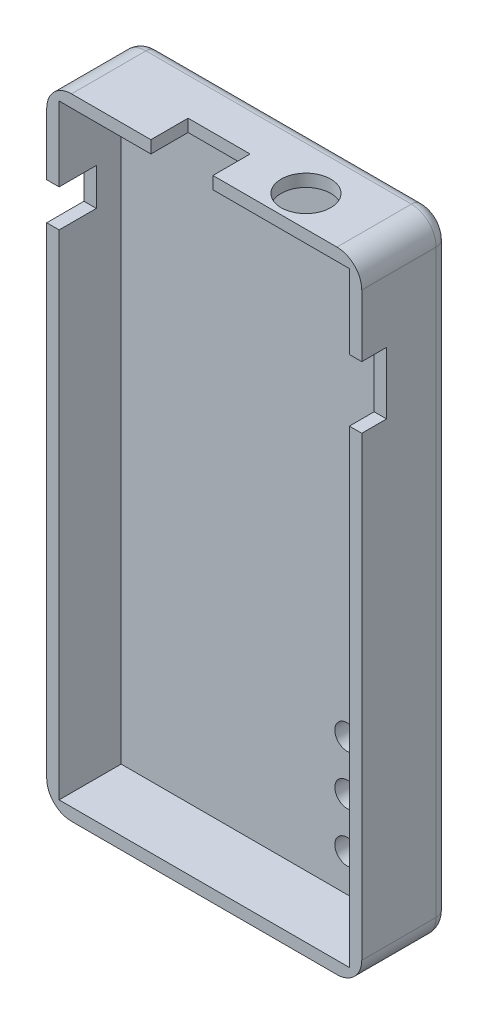
from build123d import *

# Parameters (mm, degrees)
SKETCH1_W           = 25.4
SKETCH1_H           = 50.8
BOSS_EXTRUDE1_DEPTH = 2.00000108
SKETCH2_W           = 25.4
SKETCH2_H           = 50.8
SKETCH2_W_2         = 23.39999892
SKETCH2_H_2         = 48.79999892
BOSS_EXTRUDE2_DEPTH = 4.999999906
FILLET1_R           = 2.000000064
FILLET2_R           = 1.000000032
CUT_EXTRUDE1_REACH  = 59.226
SKETCH4_W           = 2.00000108
SKETCH4_H           = 4.99999
CUT_EXTRUDE3_REACH  = 59.226
SKETCH6_R           = 1.999996
CUT_EXTRUDE4_REACH  = 59.226
SKETCH7_W           = 4.99999
SKETCH7_H           = 2.999994
CUT_EXTRUDE5_REACH  = 59.226
SKETCH8_W           = 2.999994
SKETCH8_H           = 2.999994
CUT_EXTRUDE6_REACH  = 59.226
SKETCH9_R           = 1.00000054


with BuildPart() as part:
    # Sketch1 → Boss-Extrude1 (new body)
    with BuildSketch(Plane.XY):
        with Locations((12.7, 25.4)):
            Rectangle(SKETCH1_W, SKETCH1_H)
    extrude(amount=BOSS_EXTRUDE1_DEPTH)

    # Sketch2 → Boss-Extrude2 (add)
    with BuildSketch(Plane.XY.offset(2.00000108)):
        with Locations((12.7, 25.4)):
            Rectangle(SKETCH2_W, SKETCH2_H)
        with Locations((12.7, 25.4)):
            Rectangle(SKETCH2_W_2, SKETCH2_H_2, mode=Mode.SUBTRACT)
    extrude(amount=BOSS_EXTRUDE2_DEPTH)

    # Fillet1
    fillet1_edges = [part.edges().sort_by_distance(p)[0] for p in [
        (0, 0, 3.500000493),
        (25.4, 0, 3.500000493),
        (0, 50.8, 3.500000493),
        (25.4, 50.8, 3.500000493),
    ]]
    fillet(fillet1_edges, radius=FILLET1_R)

    # Fillet2
    fillet2_edges = [part.edges().sort_by_distance(p)[0] for p in [
        (24.814213544, 0.585786456, 0),
        (12.7, 0, 0),
        (0.585786456, 0.585786456, 0),
        (0, 25.4, 0),
        (0.585786456, 50.214213544, 0),
        (12.7, 50.8, 0),
        (24.814213544, 50.214213544, 0),
        (25.4, 25.4, 0),
    ]]
    fillet(fillet2_edges, radius=FILLET2_R)

    # Sketch4 → Cut-Extrude1 (cut, up to next)
    with BuildSketch(Plane(origin=(25.4, 0, 0), x_dir=(0, 0, -1), z_dir=(1, 0, 0)), mode=Mode.PRIVATE) as cut_extrude1_sk1:
        with Locations((-6.000000446, 41.300014936)):
            Rectangle(SKETCH4_W, SKETCH4_H)
    cut_extrude1_tool1 = extrude(cut_extrude1_sk1.sketch, amount=-CUT_EXTRUDE1_REACH, mode=Mode.PRIVATE) & part.part
    add(cut_extrude1_tool1.solids().sort_by_distance((25.4, 41.300015, 6))[0], mode=Mode.SUBTRACT)

    # Sketch6 → Cut-Extrude3 (cut, up to next)
    with BuildSketch(Plane(origin=(0, 50.8, 0), x_dir=(1, 0, 0), z_dir=(0, 1, 0)), mode=Mode.PRIVATE) as cut_extrude3_sk1:
        with Locations((18.400009936, -4.500000906)):
            Circle(SKETCH6_R)
    cut_extrude3_tool1 = extrude(cut_extrude3_sk1.sketch, amount=-CUT_EXTRUDE3_REACH, mode=Mode.PRIVATE) & part.part
    add(cut_extrude3_tool1.solids().sort_by_distance((18.40001, 50.8, 4.500001))[0], mode=Mode.SUBTRACT)

    # Sketch7 → Cut-Extrude4 (cut, up to next)
    with BuildSketch(Plane(origin=(0, 50.8, 0), x_dir=(1, 0, 0), z_dir=(0, 1, 0)), mode=Mode.PRIVATE) as cut_extrude4_sk1:
        with Locations((10.899999536, -5.500003986)):
            Rectangle(SKETCH7_W, SKETCH7_H)
    cut_extrude4_tool1 = extrude(cut_extrude4_sk1.sketch, amount=-CUT_EXTRUDE4_REACH, mode=Mode.PRIVATE) & part.part
    add(cut_extrude4_tool1.solids().sort_by_distance((10.9, 50.8, 5.500004))[0], mode=Mode.SUBTRACT)

    # Sketch8 → Cut-Extrude5 (cut, up to next)
    with BuildSketch(Plane.ZY, mode=Mode.PRIVATE) as cut_extrude5_sk1:
        with Locations((5.500003986, 42.300012936)):
            Rectangle(SKETCH8_W, SKETCH8_H)
    cut_extrude5_tool1 = extrude(cut_extrude5_sk1.sketch, amount=-CUT_EXTRUDE5_REACH, mode=Mode.PRIVATE) & part.part
    add(cut_extrude5_tool1.solids().sort_by_distance((0, 42.300013, 5.500004))[0], mode=Mode.SUBTRACT)

    # Sketch9 → Cut-Extrude6 (cut, up to next)
    with BuildSketch(Plane(origin=(0, 0, 0), x_dir=(-1, 0, 0), z_dir=(0, 0, -1)), mode=Mode.PRIVATE) as cut_extrude6_sk1:
        with Locations((-19.229729662, 3.999994032)):
            Circle(SKETCH9_R)
    cut_extrude6_tool1 = extrude(cut_extrude6_sk1.sketch, amount=-CUT_EXTRUDE6_REACH, mode=Mode.PRIVATE) & part.part
    # Sketch9 → Cut-Extrude6 (cut, up to next)
    with BuildSketch(Plane(origin=(0, 0, 0), x_dir=(-1, 0, 0), z_dir=(0, 0, -1)), mode=Mode.PRIVATE) as cut_extrude6_sk2:
        with Locations((-19.229729662, 7.999986032)):
            Circle(SKETCH9_R)
    cut_extrude6_tool2 = extrude(cut_extrude6_sk2.sketch, amount=-CUT_EXTRUDE6_REACH, mode=Mode.PRIVATE) & part.part
    # Sketch9 → Cut-Extrude6 (cut, up to next)
    with BuildSketch(Plane(origin=(0, 0, 0), x_dir=(-1, 0, 0), z_dir=(0, 0, -1)), mode=Mode.PRIVATE) as cut_extrude6_sk3:
        with Locations((-19.229729662, 11.999978032)):
            Circle(SKETCH9_R)
    cut_extrude6_tool3 = extrude(cut_extrude6_sk3.sketch, amount=-CUT_EXTRUDE6_REACH, mode=Mode.PRIVATE) & part.part
    add(cut_extrude6_tool1.solids().sort_by_distance((19.22973, 3.999994, 0))[0], mode=Mode.SUBTRACT)
    add(cut_extrude6_tool2.solids().sort_by_distance((19.22973, 7.999986, 0))[0], mode=Mode.SUBTRACT)
    add(cut_extrude6_tool3.solids().sort_by_distance((19.22973, 11.999978, 0))[0], mode=Mode.SUBTRACT)


solid = part.part
